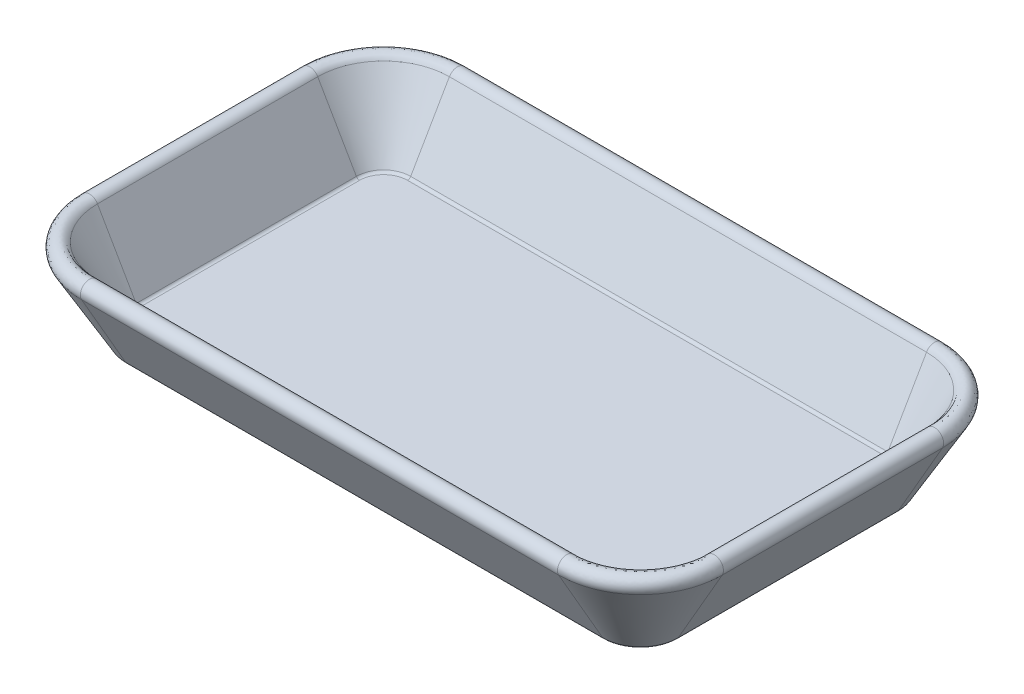
from build123d import *

# Parameters (mm, degrees)
BOSS_EXTRUDE1_DEPTH = 25
BOSS_EXTRUDE1_DRAFT = -30
SHELL1_T            = -5
FILLET1_R           = 1
FILLET2_R           = 2.5
FILLET3_R           = 1


with BuildPart() as part:
    # Sketch1 → Boss-Extrude1 (with draft: the straight prism first)
    with BuildSketch(Plane(origin=(0, 0, 0), x_dir=(1, 0, 0), z_dir=(0, 1, 0))):
        with BuildLine():
            Line((-65, -40), (65, -40))
            ThreePointArc((65, -40), (72.071067812, -37.071067812), (75, -30))
            Line((75, -30), (75, 30))
            ThreePointArc((75, 30), (72.071067812, 37.071067812), (65, 40))
            Line((65, 40), (-65, 40))
            ThreePointArc((-65, 40), (-72.071067812, 37.071067812), (-75, 30))
            Line((-75, 30), (-75, -30))
            ThreePointArc((-75, -30), (-72.071067812, -37.071067812), (-65, -40))
        make_face()
    extrude(amount=BOSS_EXTRUDE1_DEPTH)
    # Boss-Extrude1: the draft: its side faces are tilted about the plane it starts from
    boss_extrude1_sides = [part.faces().sort_by_distance(p)[0] for p in [
        (0, 12.5, 40),
        (72.071067812, 12.5, 37.071067812),
        (75, 12.5, 0),
        (72.071067812, 12.5, -37.071067812),
        (0, 12.5, -40),
        (-72.071067812, 12.5, -37.071067812),
        (-75, 12.5, 0),
        (-72.071067812, 12.5, 37.071067812),
    ]]
    draft(boss_extrude1_sides, Plane(origin=(0, 0, 0), x_dir=(1, 0, 0), z_dir=(0, 1, 0)), BOSS_EXTRUDE1_DRAFT)

    # Shell1
    shell1_openings = [part.faces().sort_by_distance(p)[0] for p in [
        (0, 25, 0),
    ]]
    offset(amount=SHELL1_T, openings=shell1_openings, kind=Kind.INTERSECTION)

    # Fillet1
    fillet1_edges = [part.edges().sort_by_distance(p)[0] for p in [
        (70.02982636, 5, -35.02982636),
        (0, 5, -37.113248654),
        (-70.02982636, 5, -35.02982636),
        (-72.113248654, 5, 0),
        (-70.02982636, 5, 35.02982636),
        (0, 5, 37.113248654),
        (70.02982636, 5, 35.02982636),
        (72.113248654, 5, 0),
    ]]
    fillet(fillet1_edges, radius=FILLET1_R)

    # Fillet2
    fillet2_edges = [part.edges().sort_by_distance(p)[0] for p in [
        (-89.43375673, 25, 0),
        (0, 25, 54.43375673),
        (89.43375673, 25, 0),
        (0, 25, -48.660254038),
        (-83.660254038, 25, 0),
        (0, 25, 48.660254038),
        (83.660254038, 25, 0),
        (0, 25, -54.43375673),
    ]]
    fillet(fillet2_edges, radius=FILLET2_R - 0.0001)  # a hair under: the kernel refuses the full size

    # Fillet3
    fillet3_edges = [part.edges().sort_by_distance(p)[0] for p in [
        (-75, 0, 0),
        (-72.071067812, 0, -37.071067812),
        (0, 0, -40),
        (72.071067812, 0, -37.071067812),
        (75, 0, 0),
        (72.071067812, 0, 37.071067812),
        (0, 0, 40),
        (-72.071067812, 0, 37.071067812),
    ]]
    fillet(fillet3_edges, radius=FILLET3_R)


solid = part.part
